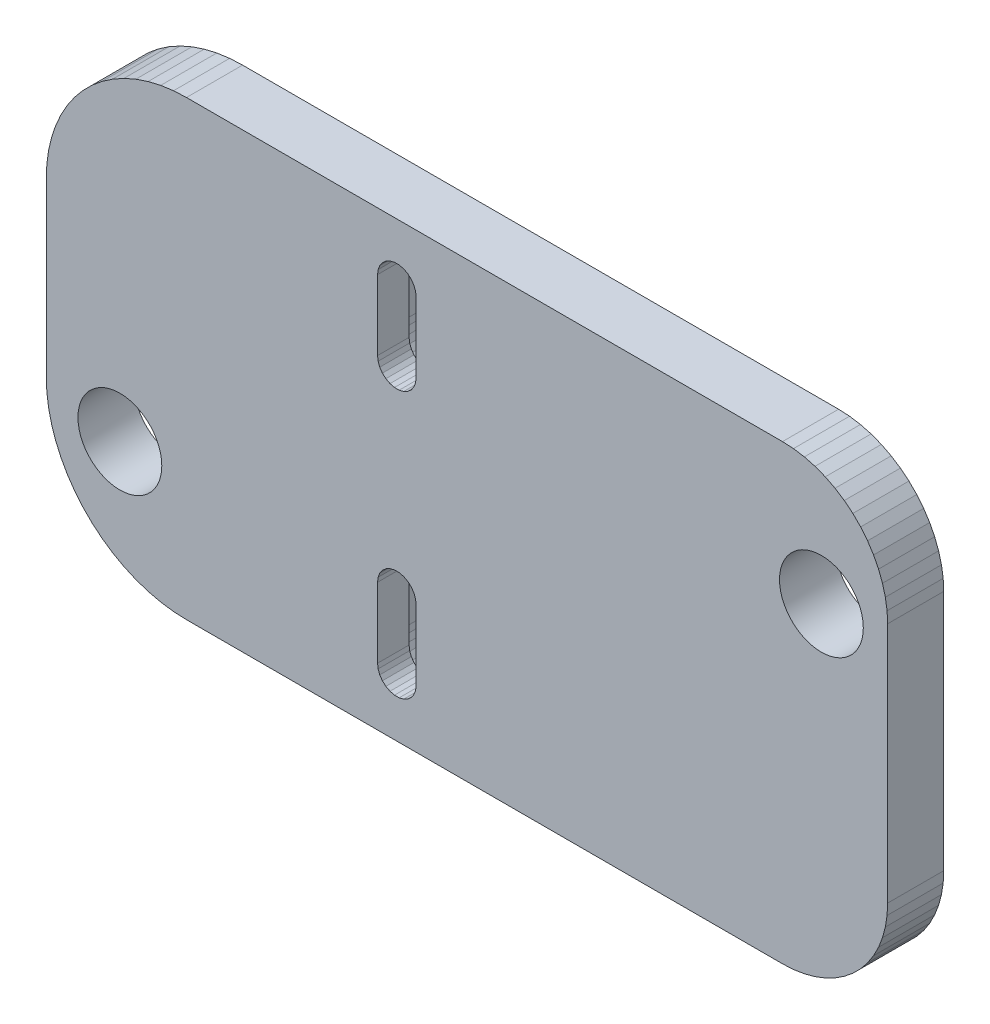
from build123d import *
from OCP.BRepAlgoAPI import BRepAlgoAPI_Cut
from OCP.TopTools import TopTools_ListOfShape

# Parameters (mm, degrees)
BOSS_EXTRUDE1_DEPTH = 8.00000038
CUT_EXTRUDE1_DEPTH  = 3.500000108
CUT_EXTRUDE2_DEPTH  = 112.008450873
CUT_EXTRUDE3_DEPTH  = 3.500000108
CUT_EXTRUDE4_DEPTH  = 112.008450873
CUT_EXTRUDE5_DEPTH  = 112.008450873
CUT_EXTRUDE6_DEPTH  = 112.008450873
SKETCH8_W           = 15.985088838
SKETCH8_H           = 15.232849363
SKETCH8_W_2         = 16.2937302
SKETCH8_H_2         = 16.446722972
BOSS_EXTRUDE2_DEPTH = 8
SKETCH9_R           = 5.978386297
SKETCH9_R_2         = 5.97611532
CUT_EXTRUDE7_DEPTH  = 12


with BuildPart() as part:
    # Sketch1 → Boss-Extrude1 (new body)
    with BuildSketch(Plane.XY.offset(8.00000038)):
        Polygon((13.316779397, 15.174240805), (12.000000104, 16.029367223), (10.601049289, 16.742167994), (9.135254659, 17.304833978), (7.618675008, 17.71119982), (6.067926995, 17.956813797), (4.499999806, 18.038986251), (-80.499999225, 18.038986251), (-82.345366478, 17.95366779), (-84.174990654, 17.698448151), (-85.973255336, 17.27549918), (-87.72482723, 16.688430682), (-89.414767921, 15.94225131), (-91.028638184, 15.043328516), (-92.552699149, 13.999330811), (-93.973912299, 12.819164433), (-95.280185342, 11.51289884), (-96.460342407, 10.091678239), (-97.504340112, 8.567628451), (-98.403267562, 6.953753065), (-99.149443209, 5.263819359), (-99.736511707, 3.512245603), (-100.159458816, 1.713976264), (-100.414678454, -0.115646872), (-100.500002503, -1.961014001), (-100.500002503, -26.461014524), (-100.414678454, -28.306381777), (-100.159458816, -30.13600409), (-99.736511707, -31.934276223), (-99.149443209, -33.685848117), (-98.403267562, -35.375781357), (-97.504340112, -36.989659071), (-96.460342407, -38.513705134), (-95.280185342, -39.934925735), (-93.973912299, -41.241191328), (-92.552699149, -42.421359569), (-91.028638184, -43.465353549), (-89.414767921, -44.364280999), (-87.72482723, -45.110456645), (-85.973255336, -45.697525144), (-84.174990654, -46.120475978), (-82.345366478, -46.375699341), (-80.499999225, -46.461012214), (4.499999806, -46.461012214), (6.067926995, -46.378839761), (7.618675008, -46.133227646), (9.135254659, -45.726861805), (10.601049289, -45.164197683), (12.000000104, -44.451396912), (13.316779397, -43.5962677), (14.536959119, -42.608186603), (15.647171065, -41.497975588), (16.635255888, -40.277794003), (17.490381375, -38.961015642), (18.203182146, -37.562064826), (18.76584813, -36.096267402), (19.172213972, -34.579690546), (19.417827949, -33.028941602), (19.500000402, -31.461015344), (19.500000402, 3.038985888), (19.417827949, 4.60691331), (19.172213972, 6.157661323), (18.76584813, 7.674240973), (18.203182146, 9.140036069), (17.490381375, 10.538985953), (16.635255888, 11.855764315), (15.647171065, 13.075944968), (14.536959119, 14.186157845), align=None)
    extrude(amount=-BOSS_EXTRUDE1_DEPTH)

    # Sketch2 → Cut-Extrude1 (cut)
    with BuildSketch(Plane(origin=(0, 0, 0), x_dir=(-1, 0, 0), z_dir=(0, 0, -1))):
        Polygon((47.125365585, -24.189282209), (46.478267759, -24.836380035), (45.953366905, -25.586014614), (45.566610992, -26.41540952), (45.329757035, -27.299359441), (45.249998569, -28.211014345), (45.249998569, -38.211014122), (45.329757035, -39.122667164), (45.566610992, -40.006618947), (45.953366905, -40.836013854), (46.478267759, -41.58564657), (47.125365585, -42.232744396), (47.874998301, -42.757648975), (48.704396933, -43.144401163), (49.588348716, -43.38125512), (50.500001758, -43.461013585), (51.411651075, -43.38125512), (52.295602858, -43.144401163), (53.12500149, -42.757648975), (53.874634206, -42.232744396), (54.521732032, -41.58564657), (55.046632886, -40.836013854), (55.433388799, -40.006618947), (55.670242757, -39.122667164), (55.750001222, -38.211014122), (55.750001222, -28.211014345), (55.670242757, -27.299359441), (55.433388799, -26.41540952), (55.046632886, -25.586014614), (54.521732032, -24.836380035), (53.874634206, -24.189282209), (53.12500149, -23.664381355), (52.295602858, -23.277627304), (51.411651075, -23.040773347), (50.500001758, -22.961013019), (49.588348716, -23.040773347), (48.704396933, -23.277627304), (47.874998301, -23.664381355), align=None)
    extrude(amount=-CUT_EXTRUDE1_DEPTH, mode=Mode.SUBTRACT)

    # Sketch3 → Cut-Extrude2 (cut, through all)
    with BuildSketch(Plane.XY.offset(8.00000038)):
        Polygon((-49.524836242, -25.639718398), (-50.168525428, -25.481063873), (-50.831474364, -25.481063873), (-51.475163549, -25.639718398), (-52.062179893, -25.947809219), (-52.558403462, -26.387427002), (-52.935004234, -26.933025569), (-53.170088679, -27.552897111), (-53.249999881, -28.211014345), (-53.249999881, -38.211014122), (-53.170088679, -38.869131356), (-52.935004234, -39.489001036), (-52.558403462, -40.034603328), (-52.062179893, -40.47422111), (-51.475163549, -40.782310069), (-50.831474364, -40.940962732), (-50.168525428, -40.940962732), (-49.524836242, -40.782310069), (-48.937819898, -40.47422111), (-48.441596329, -40.034603328), (-48.064995557, -39.489001036), (-47.829911113, -38.869131356), (-47.749999911, -38.211014122), (-47.749999911, -28.211014345), (-47.829911113, -27.552897111), (-48.064995557, -26.933025569), (-48.441596329, -26.387427002), (-48.937819898, -25.947809219), align=None)
    extrude(amount=-CUT_EXTRUDE2_DEPTH, mode=Mode.SUBTRACT)

    # Sketch4 → Cut-Extrude3 (cut)
    with BuildSketch(Plane(origin=(0, 0, 0), x_dir=(-1, 0, 0), z_dir=(0, 0, -1))):
        Polygon((47.125365585, 13.810719363), (46.478267759, 13.163620606), (45.953366905, 12.413986027), (45.566610992, 11.584592052), (45.329757035, 10.700638406), (45.249998569, 9.788986295), (45.249998569, -0.211014063), (45.329757035, -1.122666989), (45.566610992, -2.006619703), (45.953366905, -2.836014144), (46.478267759, -3.585648956), (47.125365585, -4.23274748), (47.874998301, -4.757647403), (48.704396933, -5.144400056), (49.588348716, -5.381254479), (50.500001758, -5.461014342), (51.411651075, -5.381254479), (52.295602858, -5.144400056), (53.12500149, -4.757647403), (53.874634206, -4.23274748), (54.521732032, -3.585648956), (55.046632886, -2.836014144), (55.433388799, -2.006619703), (55.670242757, -1.122666989), (55.750001222, -0.211014063), (55.750001222, 9.788986295), (55.670242757, 10.700638406), (55.433388799, 11.584592052), (55.046632886, 12.413986027), (54.521732032, 13.163620606), (53.874634206, 13.810719363), (53.12500149, 14.335619286), (52.295602858, 14.722372405), (51.411651075, 14.959226362), (50.500001758, 15.038985759), (49.588348716, 14.959226362), (48.704396933, 14.722372405), (47.874998301, 14.335619286), align=None)
    extrude(amount=-CUT_EXTRUDE3_DEPTH, mode=Mode.SUBTRACT)

    # Sketch5 → Cut-Extrude4 (cut, through all)
    with BuildSketch(Plane.XY.offset(8.00000038)):
        Polygon((-50.831474364, -2.940963488), (-50.168525428, -2.940963488), (-49.524836242, -2.782308729), (-48.937819898, -2.474219771), (-48.441596329, -2.034601523), (-48.064995557, -1.48900284), (-47.829911113, -0.869132171), (-47.749999911, -0.211014063), (-47.749999911, 9.788986295), (-47.829911113, 10.447104461), (-48.064995557, 11.066975072), (-48.441596329, 11.612573639), (-48.937819898, 12.052191421), (-49.524836242, 12.360281311), (-50.168525428, 12.518934906), (-50.831474364, 12.518934906), (-51.475163549, 12.360281311), (-52.062179893, 12.052191421), (-52.558403462, 11.612573639), (-52.935004234, 11.066975072), (-53.170088679, 10.447104461), (-53.249999881, 9.788986295), (-53.249999881, -0.211014063), (-53.170088679, -0.869132171), (-52.935004234, -1.48900284), (-52.558403462, -2.034601523), (-52.062179893, -2.474219771), (-51.475163549, -2.782308729), align=None)
    extrude(amount=-CUT_EXTRUDE4_DEPTH, mode=Mode.SUBTRACT)

    # Sketch6 → Cut-Extrude5 (cut, through all)
    with BuildSketch(Plane(origin=(0, 0, 0), x_dir=(-1, 0, 0), z_dir=(0, 0, -1))):
        Polygon((-7.762861438, 6.356319878), (-8.735924959, 6.654317491), (-9.745352902, 6.783579942), (-10.762106627, 6.74038846), (-11.75693702, 6.525986362), (-12.701222673, 6.146541331), (-13.567798771, 5.612968933), (-14.331736602, 4.940618761), (-14.971057884, 4.148834851), (-15.46737086, 3.260393394), (-15.806397423, 2.300854307), (-15.978384763, 1.297821524), (-15.978384763, 0.280150387), (-15.806397423, -0.722882454), (-15.46737086, -1.682421542), (-14.971057884, -2.570862882), (-14.331736602, -3.362647258), (-13.567798771, -4.034996964), (-12.701222673, -4.568569362), (-11.75693702, -4.948014393), (-10.762106627, -5.162416492), (-9.745352902, -5.205607973), (-8.735924959, -5.076345522), (-7.762861438, -4.778348375), (-6.854156498, -4.320188891), (-6.035951432, -3.715047846), (-5.331785884, -2.980333986), (-4.761915188, -2.137183677), (-4.342735279, -1.209852868), (-4.086304456, -0.225018972), (-4.00000019, 0.788985984), (-4.086304456, 1.802990912), (-4.342735279, 2.78782472), (-4.761915188, 3.715155646), (-5.331785884, 4.558305722), (-6.035951432, 5.293019582), (-6.854156498, 5.89816086), align=None)
    extrude(amount=-CUT_EXTRUDE5_DEPTH, mode=Mode.SUBTRACT)

    # Sketch7 → Cut-Extrude6 (cut, through all)
    with BuildSketch(Plane(origin=(0, 0, 0), x_dir=(-1, 0, 0), z_dir=(0, 0, -1))):
        Polygon((87.298773229, -23.853458464), (86.4321962, -24.387031794), (85.66826582, -25.0593815), (85.028938949, -25.851165876), (84.532633424, -26.739606634), (84.193602204, -27.69914642), (84.021613002, -28.70217897), (84.021613002, -29.719850048), (84.193602204, -30.722882599), (84.532633424, -31.682420522), (85.028938949, -32.57086128), (85.66826582, -33.362649381), (86.4321962, -34.034997225), (87.298773229, -34.568570554), (88.243067265, -34.948013723), (89.237891138, -35.162419081), (90.25464952, -35.205610096), (91.264076531, -35.076346248), (92.237137258, -34.778345376), (93.14583987, -34.320190549), (93.96404773, -33.715050668), (94.668209553, -32.980334014), (95.238082111, -32.137185335), (95.657266676, -31.209852546), (95.913693309, -30.225019902), (96.000000834, -29.211014509), (95.913693309, -28.197009116), (95.657266676, -27.212174609), (95.238082111, -26.284843683), (94.668209553, -25.441695005), (93.96404773, -24.706980214), (93.14583987, -24.10183847), (92.237137258, -23.643679917), (91.264076531, -23.34568277), (90.25464952, -23.216420785), (89.237891138, -23.2596118), (88.243067265, -23.474013433), align=None)
    extrude(amount=-CUT_EXTRUDE6_DEPTH, mode=Mode.SUBTRACT)

    # Sketch8 → Boss-Extrude2 (add)
    with BuildSketch(Plane.XY.offset(8.00000038)):
        with Locations((-88.912365618, -29.182203033)):
            Rectangle(SKETCH8_W, SKETCH8_H)
        with Locations((9.2896202, -0.106897779)):
            Rectangle(SKETCH8_W_2, SKETCH8_H_2)
    extrude(amount=-BOSS_EXTRUDE2_DEPTH)


with BuildPart() as cut_extrude7_tool:
    # Sketch9 → Cut-Extrude7 (new body)
    with BuildSketch(Plane.XY.offset(12.00000038)):
        with Locations((-90.000002671, -29.211014044)):
            Circle(SKETCH9_R)
        with Locations((10.052707617, 0.779948287)):
            Circle(SKETCH9_R_2)
    extrude(amount=-CUT_EXTRUDE7_DEPTH)


with BuildPart() as part_1:
    add(part.part)

    # Cut-Extrude7: cut by cut_extrude7_tool, with a tolerance
    cut_extrude7_stock = TopTools_ListOfShape()
    cut_extrude7_stock.Append(part_1.part.wrapped)
    cut_extrude7_tools = TopTools_ListOfShape()
    cut_extrude7_tools.Append(cut_extrude7_tool.part.wrapped)
    cut_extrude7_cut = BRepAlgoAPI_Cut()
    cut_extrude7_cut.SetArguments(cut_extrude7_stock)
    cut_extrude7_cut.SetTools(cut_extrude7_tools)
    cut_extrude7_cut.SetFuzzyValue(0.00001)
    cut_extrude7_cut.Build()
    add(Compound.cast(cut_extrude7_cut.Shape()).solids(), mode=Mode.REPLACE)


solid = part_1.part
